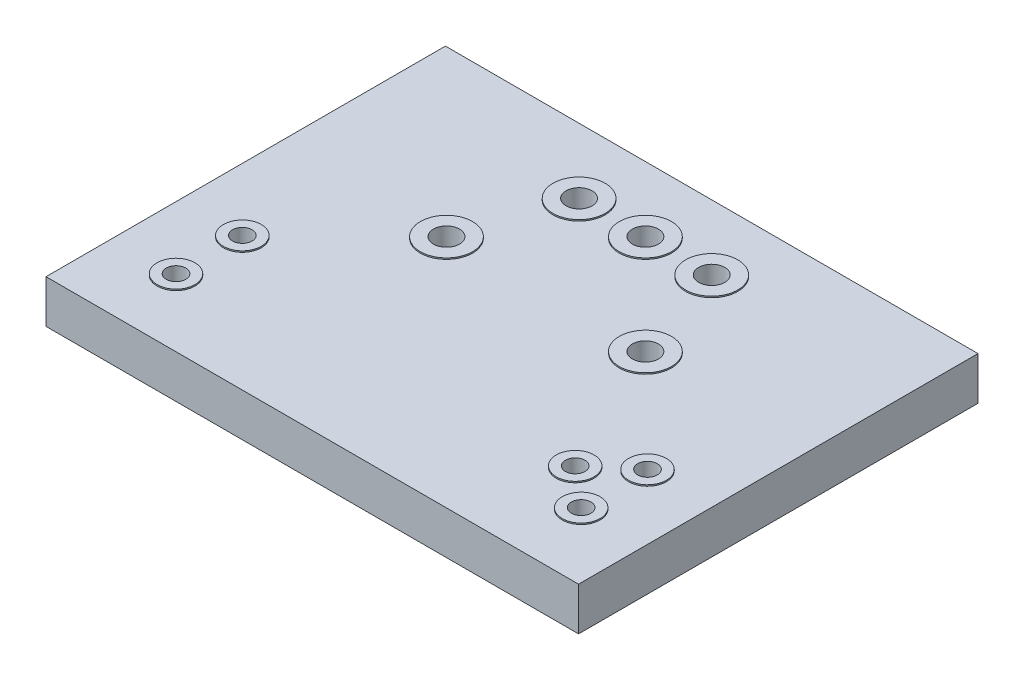
from build123d import *

# Parameters (mm, degrees)
SKETCH3_W           = 20.4
SKETCH3_H           = 15.3
SKETCH3_R           = 0.5
SKETCH3_R_2         = 0.375
BOSS_EXTRUDE2_DEPTH = 0.825
SKETCH5_R           = 1
SKETCH5_R_2         = 0.5
SKETCH5_R_3         = 0.725
SKETCH5_R_4         = 0.375
BOSS_EXTRUDE3_DEPTH = 0.05


with BuildPart() as part:
    # Sketch3 → Boss-Extrude2 (new, symmetric)
    with BuildSketch(Plane(origin=(0, 0, 0), x_dir=(1, 0, 0), z_dir=(0, 1, 0))):
        Rectangle(SKETCH3_W, SKETCH3_H)
        with Locations((-2.54, 5.11)):
            Circle(SKETCH3_R, mode=Mode.SUBTRACT)
        with Locations((0, 5.11)):
            Circle(SKETCH3_R, mode=Mode.SUBTRACT)
        with Locations((2.54, 5.11)):
            Circle(SKETCH3_R, mode=Mode.SUBTRACT)
        with Locations((-7.76, -2.57)):
            Circle(SKETCH3_R_2, mode=Mode.SUBTRACT)
        with Locations((-7.76, -5.11)):
            Circle(SKETCH3_R_2, mode=Mode.SUBTRACT)
        with Locations((7.76, -2.57)):
            Circle(SKETCH3_R_2, mode=Mode.SUBTRACT)
        with Locations((7.76, -5.11)):
            Circle(SKETCH3_R_2, mode=Mode.SUBTRACT)
        with Locations((6.260003, -3.84)):
            Circle(SKETCH3_R_2, mode=Mode.SUBTRACT)
        with Locations((-3.81, 1.3)):
            Circle(SKETCH3_R, mode=Mode.SUBTRACT)
        with Locations((3.81, 1.3)):
            Circle(SKETCH3_R, mode=Mode.SUBTRACT)
    extrude(amount=BOSS_EXTRUDE2_DEPTH, both=True)

    # Sketch5 → Boss-Extrude3 (add)
    # profile 1 of 10: a face of its own
    with BuildSketch(Plane(origin=(0, 0.825, 0), x_dir=(1, 0, 0), z_dir=(0, 1, 0))):
        with Locations((-2.54, 5.11)):
            Circle(SKETCH5_R)
        with Locations((-2.54, 5.11)):
            Circle(SKETCH5_R_2, mode=Mode.SUBTRACT)
    # profile 2 of 10: a face of its own
    with BuildSketch(Plane(origin=(0, 0.825, 0), x_dir=(1, 0, 0), z_dir=(0, 1, 0))):
        with Locations((0, 5.11)):
            Circle(SKETCH5_R)
        with Locations((0, 5.11)):
            Circle(SKETCH5_R_2, mode=Mode.SUBTRACT)
    # profile 3 of 10: a face of its own
    with BuildSketch(Plane(origin=(0, 0.825, 0), x_dir=(1, 0, 0), z_dir=(0, 1, 0))):
        with Locations((2.54, 5.11)):
            Circle(SKETCH5_R)
        with Locations((2.54, 5.11)):
            Circle(SKETCH5_R_2, mode=Mode.SUBTRACT)
    # profile 4 of 10: a face of its own
    with BuildSketch(Plane(origin=(0, 0.825, 0), x_dir=(1, 0, 0), z_dir=(0, 1, 0))):
        with Locations((3.81, 1.3)):
            Circle(SKETCH5_R)
        with Locations((3.81, 1.3)):
            Circle(SKETCH5_R_2, mode=Mode.SUBTRACT)
    # profile 5 of 10: a face of its own
    with BuildSketch(Plane(origin=(0, 0.825, 0), x_dir=(1, 0, 0), z_dir=(0, 1, 0))):
        with Locations((-3.81, 1.3)):
            Circle(SKETCH5_R)
        with Locations((-3.81, 1.3)):
            Circle(SKETCH5_R_2, mode=Mode.SUBTRACT)
    # profile 6 of 10: a face of its own
    with BuildSketch(Plane(origin=(0, 0.825, 0), x_dir=(1, 0, 0), z_dir=(0, 1, 0))):
        with Locations((-7.76, -2.57)):
            Circle(SKETCH5_R_3)
        with Locations((-7.76, -2.57)):
            Circle(SKETCH5_R_4, mode=Mode.SUBTRACT)
    # profile 7 of 10: a face of its own
    with BuildSketch(Plane(origin=(0, 0.825, 0), x_dir=(1, 0, 0), z_dir=(0, 1, 0))):
        with Locations((-7.76, -5.11)):
            Circle(SKETCH5_R_3)
        with Locations((-7.76, -5.11)):
            Circle(SKETCH5_R_4, mode=Mode.SUBTRACT)
    # profile 8 of 10: a face of its own
    with BuildSketch(Plane(origin=(0, 0.825, 0), x_dir=(1, 0, 0), z_dir=(0, 1, 0))):
        with Locations((6.260003, -3.84)):
            Circle(SKETCH5_R_3)
        with Locations((6.260003, -3.84)):
            Circle(SKETCH5_R_4, mode=Mode.SUBTRACT)
    # profile 9 of 10: a face of its own
    with BuildSketch(Plane(origin=(0, 0.825, 0), x_dir=(1, 0, 0), z_dir=(0, 1, 0))):
        with Locations((7.76, -5.11)):
            Circle(SKETCH5_R_3)
        with Locations((7.76, -5.11)):
            Circle(SKETCH5_R_4, mode=Mode.SUBTRACT)
    # profile 10 of 10: a face of its own
    with BuildSketch(Plane(origin=(0, 0.825, 0), x_dir=(1, 0, 0), z_dir=(0, 1, 0))):
        with Locations((7.76, -2.57)):
            Circle(SKETCH5_R_3)
        with Locations((7.76, -2.57)):
            Circle(SKETCH5_R_4, mode=Mode.SUBTRACT)
    boss_extrude3 = extrude(amount=BOSS_EXTRUDE3_DEPTH)

    # Mirror1: Boss-Extrude3 across plane
    add(boss_extrude3.mirror(Plane.ZX))


solid = part.part
